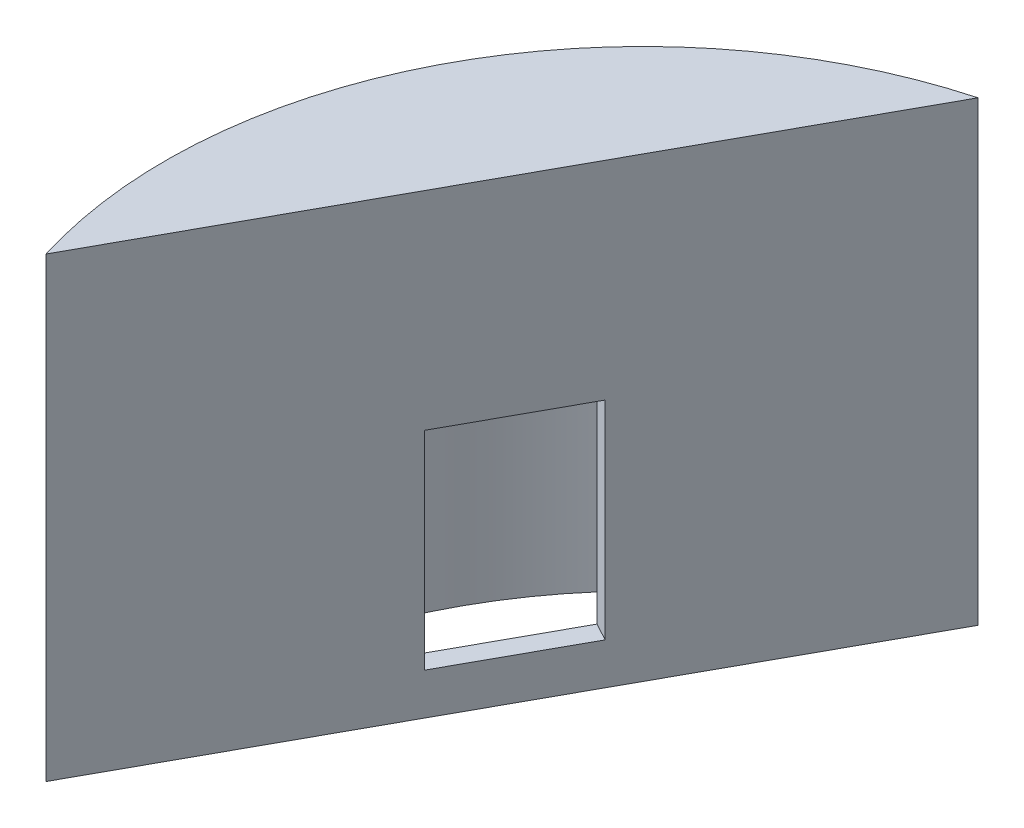
from build123d import *

# Parameters (mm, degrees)
SKETCH1_R           = 73.025
SKETCH1_R_2         = 69.85
BOSS_EXTRUDE1_DEPTH = 63.5
BOSS_EXTRUDE2_START = 6.35
SKETCH2_R           = 73.025
BOSS_EXTRUDE2_DEPTH = 6.35
BOSS_EXTRUDE3_DEPTH = 63.5
CUT_EXTRUDE2_START  = -76.2
CUT_EXTRUDE2_DEPTH  = 69.85
CUT_EXTRUDE4_START  = 19.05
SKETCH6_W           = 20.32
SKETCH6_H           = 31.75
CUT_EXTRUDE4_DEPTH  = 31.75
CUT_EXTRUDE5_DEPTH  = 1016


with BuildPart() as part:
    # Sketch1 → Boss-Extrude1 (new body)
    with BuildSketch(Plane(origin=(0, 0, 0), x_dir=(1, 0, 0), z_dir=(0, 1, 0))):
        Circle(SKETCH1_R)
        Circle(SKETCH1_R_2, mode=Mode.SUBTRACT)
    extrude(amount=BOSS_EXTRUDE1_DEPTH)

    # Sketch2 → Boss-Extrude2 (add)
    with BuildSketch(Plane.XZ.offset(BOSS_EXTRUDE2_START)):
        Circle(SKETCH2_R)
    extrude(amount=-BOSS_EXTRUDE2_DEPTH)

    # Sketch3 → Boss-Extrude3 (add)
    with BuildSketch(Plane(origin=(0, 0, 0), x_dir=(1, 0, 0), z_dir=(0, 1, 0))):
        with BuildLine():
            Line((-67.615293174, -17.526968618), (-21.409243237, 66.488095205))
            ThreePointArc((-21.409243237, 66.488095205), (-61.204368783, 33.660774529), (-67.615293174, -17.526968618))
        make_face()
    extrude(amount=BOSS_EXTRUDE3_DEPTH)

    # Sketch4 → Cut-Extrude2 (cut)
    with BuildSketch(Plane(origin=(0, 63.5, 0), x_dir=(1, 0, 0), z_dir=(0, 1, 0)).offset(CUT_EXTRUDE2_START)):
        with BuildLine():
            Line((-25.79189716, 64.913793148), (-68.632882923, -12.982676212))
            ThreePointArc((-68.632882923, -12.982676212), (-61.204368783, 33.660774529), (-25.79189716, 64.913793148))
        make_face()
    extrude(amount=CUT_EXTRUDE2_DEPTH, mode=Mode.SUBTRACT)

    # Sketch6 → Cut-Extrude4 (cut)
    with BuildSketch(Plane(origin=(-42.286654796, 0, -23.256535129), x_dir=(0.48190085223737017, 0, -0.8762257520827018), z_dir=(0.8762257520827018, 0, 0.48190085223737017)).offset(CUT_EXTRUDE4_START)):
        with Locations((0.318551336, 15.875)):
            Rectangle(SKETCH6_W, SKETCH6_H)
    extrude(amount=-CUT_EXTRUDE4_DEPTH, mode=Mode.SUBTRACT)

    # Sketch7 → Cut-Extrude5 (cut)
    with BuildSketch(Plane(origin=(0, 63.5, 0), x_dir=(1, 0, 0), z_dir=(0, 1, 0))):
        Polygon((-72.609628953, -26.608018388), (-10.171407592, 86.921512047), (114.959945388, 65.80584256), (122.548753565, -33.748740716), (41.017949176, -93.980716613), (-75.603403444, -72.676842996), align=None)
    extrude(amount=-CUT_EXTRUDE5_DEPTH, mode=Mode.SUBTRACT)


solid = part.part
